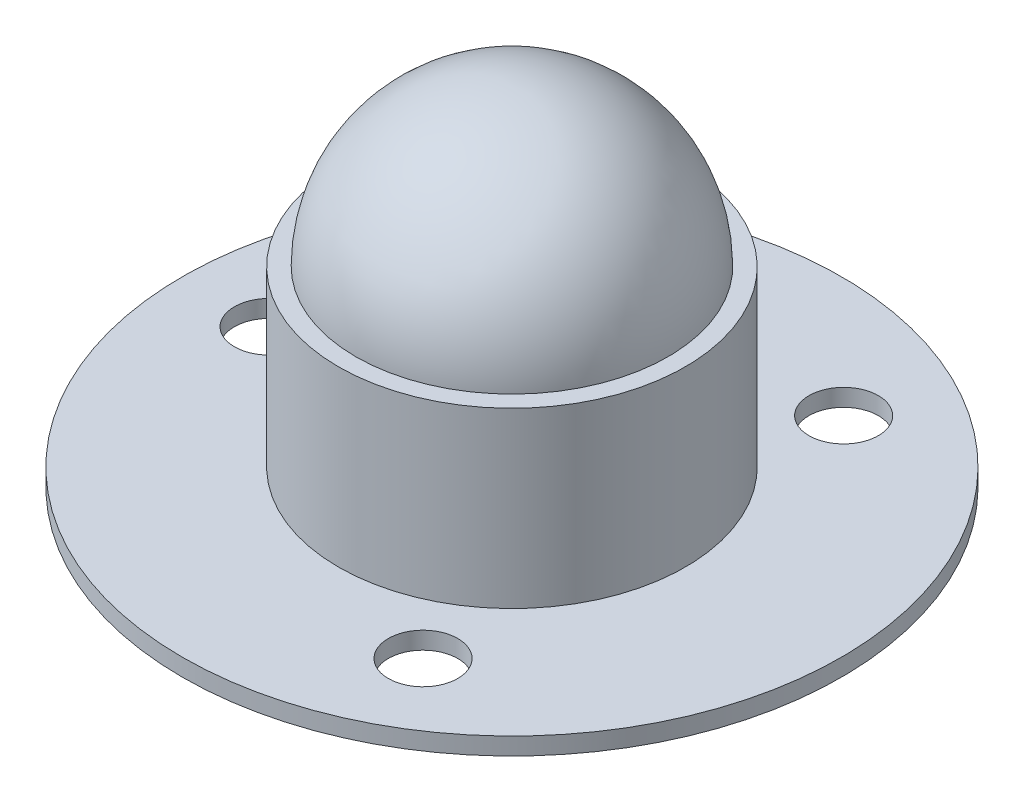
from build123d import *

# Parameters (mm, degrees)
SKETCH1_R           = 2
BOSS_EXTRUDE1_DEPTH = 0.5
SKETCH2_R           = 10
BOSS_EXTRUDE2_DEPTH = 10


with BuildPart() as part:
    # Sketch1 → Boss-Extrude1 (new, symmetric)
    with BuildSketch(Plane(origin=(0, 0, 0), x_dir=(1, 0, 0), z_dir=(0, 1, 0))):
        with BuildLine():
            ThreePointArc((19, 0), (0, 19), (-19, 0))
            ThreePointArc((-19, 0), (0, -19), (19, 0))
        make_face()
        with Locations((7, -12.124355653)):
            Circle(SKETCH1_R, mode=Mode.SUBTRACT)
        with BuildLine():
            ThreePointArc((-12, 0), (-14, -2), (-16, 0))
            ThreePointArc((-16, 0), (-14, 2), (-12, 0))
        make_face(mode=Mode.SUBTRACT)
        with Locations((7, 12.124355653)):
            Circle(SKETCH1_R, mode=Mode.SUBTRACT)
    extrude(amount=BOSS_EXTRUDE1_DEPTH, both=True)

    # Sketch2 → Boss-Extrude2 (add)
    with BuildSketch(Plane(origin=(0, 0.5, 0), x_dir=(1, 0, 0), z_dir=(0, 1, 0))):
        Circle(SKETCH2_R)
    extrude(amount=BOSS_EXTRUDE2_DEPTH)

    # Sketch3 → Revolve1 (revolve)
    with BuildSketch(Plane(origin=(0, 10.5, 0), x_dir=(1, 0, 0), z_dir=(0, 1, 0))):
        with BuildLine():
            Line((0, -9), (0, 9))
            ThreePointArc((0, 9), (-9, 0), (0, -9))
        make_face()
    revolve(axis=Axis((0, 10.5, -9), (0, 0, 1)))


solid = part.part
